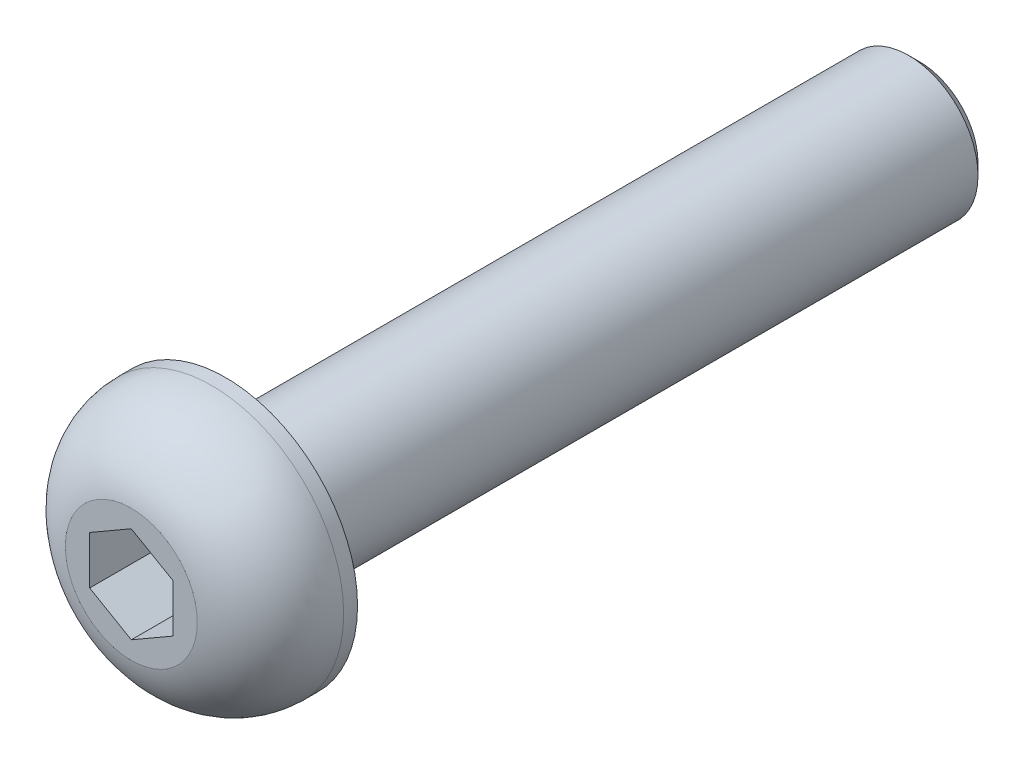
from build123d import *

# Parameters (mm, degrees)
CHAMFER1_SIZE      = 0.4
CUT_EXTRUDE1_START = -2.4000001
CUT_EXTRUDE1_DEPTH = 3.4000001
FILLET1_R          = 0.2


with BuildPart() as part:
    # Sketch1 → Revolve1 (revolve)
    with BuildSketch(Plane(origin=(0, 0, 0), x_dir=(0, 0, -1), z_dir=(1, 0, 0)), mode=Mode.PRIVATE) as revolve1_sk:
        with BuildLine():
            Line((25, 0), (25, 2.5))
            Line((25, 2.5), (0, 2.5))
            Line((0, 2.5), (0, 4.75))
            Line((0, 4.75), (-0.5, 4.75))
            ThreePointArc((-0.5, 4.75), (-2.374208166, 4.080480498), (-3.4, 2.375))
            Line((-3.4, 2.375), (-3.4, 0))
            Line((-3.4, 0), (25, 0))
        make_face()
    revolve(revolve1_sk.sketch.rotate(Axis((0, 0, 30.809969789), (0, 0, -1)), 90), axis=Axis((0, 0, 30.809969789), (0, 0, -1)))

    # Chamfer1
    chamfer1_edges = [part.edges().sort_by_distance(p)[0] for p in [
        (-2.5, 0, -25),
    ]]
    chamfer(chamfer1_edges, length=CHAMFER1_SIZE)

    # Sketch2 → Cut-Revolve1 (revolve, cut)
    with BuildSketch(Plane(origin=(0, 0, 0), x_dir=(0, 0, -1), z_dir=(1, 0, 0)), mode=Mode.PRIVATE) as cut_revolve1_sk:
        Polygon((-3.4, 0), (-3.4, 1.5), (-1, 1.5), (-0.133974596, 0), align=None)
    revolve(cut_revolve1_sk.sketch.rotate(Axis((0, 0, 2.452500839), (0, 0, -1)), 90), axis=Axis((0, 0, 2.452500839), (0, 0, -1)), mode=Mode.SUBTRACT)

    # Cut-Extrude1: read off the stored shape, not the designer's step
    # Cut-Extrude1 outline → Cut-Extrude1 (cut)
    with BuildSketch(Plane.XY.offset(3.4).offset(CUT_EXTRUDE1_START)):
        with BuildLine():
            Line((1.5, 0), (1.5, 0.866025404))
            Line((1.5, 0.866025404), (0.750000011, 1.299038099))
            ThreePointArc((0.750000011, 1.299038099), (1.299038109, 0.749999994), (1.5, 0))
        make_face()
        with BuildLine():
            ThreePointArc((-0.749999993, 1.29903811), (1e-08, 1.5), (0.750000011, 1.299038099))
            Line((0.750000011, 1.299038099), (0, 1.732050808))
            Line((0, 1.732050808), (-0.749999993, 1.29903811))
        make_face()
        with BuildLine():
            Line((1.5, -0.866025404), (1.5, 0))
            ThreePointArc((1.5, 0), (1.299038107, -0.749999997), (0.750000005, -1.299038103))
            Line((0.750000005, -1.299038103), (1.5, -0.866025404))
        make_face()
        with BuildLine():
            ThreePointArc((-1.5, 0), (-1.299038104, 0.750000003), (-0.749999993, 1.29903811))
            Line((-0.749999993, 1.29903811), (-1.5, 0.866025404))
            Line((-1.5, 0.866025404), (-1.5, 0))
        make_face()
        with BuildLine():
            Line((0, -1.732050808), (0.750000005, -1.299038103))
            ThreePointArc((0.750000005, -1.299038103), (3e-09, -1.5), (-0.75, -1.299038106))
            Line((-0.75, -1.299038106), (0, -1.732050808))
        make_face()
        with BuildLine():
            ThreePointArc((-0.75, -1.299038106), (-1.299038106, -0.75), (-1.5, 0))
            Line((-1.5, 0), (-1.5, -0.866025404))
            Line((-1.5, -0.866025404), (-0.75, -1.299038106))
        make_face()
    extrude(amount=CUT_EXTRUDE1_DEPTH, mode=Mode.SUBTRACT)

    # Cut-Extrude1 2 outline → Cut-Extrude1 2 (revolve)
    with BuildSketch(Plane.XZ):
        Polygon((1.732050837, 1.133974613), (1.499999957, 0.999999975), (1.732050808, 0.9999999), align=None)
    revolve(axis=Axis((0, 0, 0), (0, 0, 1)))

    # Fillet1
    fillet1_edges = [part.edges().sort_by_distance(p)[0] for p in [
        (-2.5, 0, 0),
    ]]
    fillet(fillet1_edges, radius=FILLET1_R)


solid = part.part
